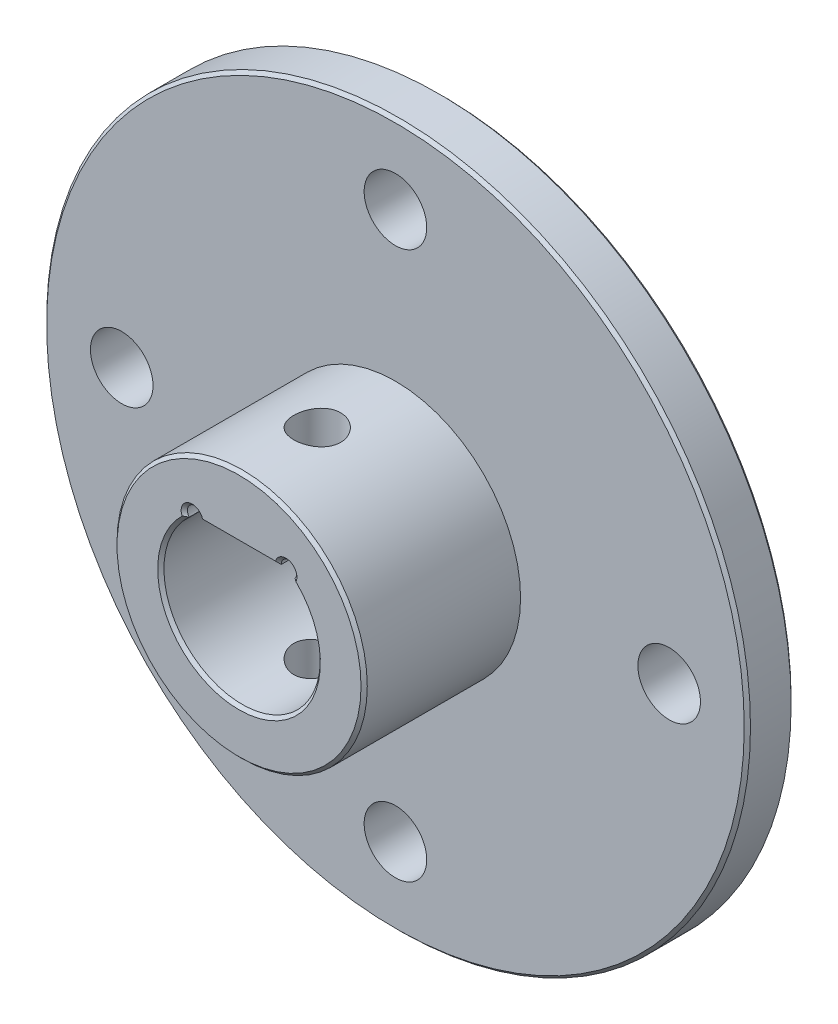
from build123d import *
from build123d.topology import SkipClean

# Parameters (mm, degrees)
SKETCH_1_R               = 22.5
SKETCH_1_R_2             = 2
EXTRUDE_1_DEPTH          = 3
SKETCH_2_R               = 8
EXTRUDE_2_DEPTH          = 10
CHAMFER_1_SIZE           = 0.2
CUT_EXTRUDE_1_DEPTH      = 35.372954485
CUT_EXTRUDE_1_DEPTH_BACK = 35.372954485
SKETCH_3_R               = 1.5


with BuildPart() as part:
    # 草图1 → 凸台-拉伸1 (new body)
    with BuildSketch(Plane.XY):
        Circle(SKETCH_1_R)
        with Locations((0, -17.5)):
            Circle(SKETCH_1_R_2, mode=Mode.SUBTRACT)
        with BuildLine():
            Line((-2.5, 4), (2.5, 4))
            ThreePointArc((2.5, 4), (3.169926685, 4.470239218), (3.384499687, 3.680375235))
            ThreePointArc((3.384499687, 3.680375235), (0, -5), (-3.384499687, 3.680375235))
            ThreePointArc((-3.384499687, 3.680375235), (-3.169926685, 4.470239218), (-2.5, 4))
        make_face(mode=Mode.SUBTRACT)
        with Locations((17.5, 0)):
            Circle(SKETCH_1_R_2, mode=Mode.SUBTRACT)
        with Locations((-17.5, 0)):
            Circle(SKETCH_1_R_2, mode=Mode.SUBTRACT)
        with Locations((0, 17.5)):
            Circle(SKETCH_1_R_2, mode=Mode.SUBTRACT)
    extrude(amount=EXTRUDE_1_DEPTH)

    # 草图2 → 凸台-拉伸2 (add)
    with SkipClean():  # the faces are left unmerged after this step: merging them gives an invalid solid
        with BuildSketch(Plane.XY.offset(3)):
            Circle(SKETCH_2_R)
            with BuildLine():
                Line((2.5, 4), (-2.5, 4))
                ThreePointArc((-2.5, 4), (-3.169926685, 4.470239218), (-3.384499687, 3.680375235))
                ThreePointArc((-3.384499687, 3.680375235), (0, -5), (3.384499687, 3.680375235))
                ThreePointArc((3.384499687, 3.680375235), (3.169926685, 4.470239218), (2.5, 4))
            make_face(mode=Mode.SUBTRACT)
        extrude(amount=EXTRUDE_2_DEPTH)

    # 倒角1
    chamfer_1_edges = [part.edges().sort_by_distance(p)[0] for p in [
        (0, -5, 13),
        (3.169926685, 4.470239218, 13),
        (-3.169926685, 4.470239218, 13),
        (0, 4, 13),
        (-8, 0, 13),
        (-22.5, 0, 0),
        (-22.5, 0, 3),
    ]]
    chamfer(chamfer_1_edges, length=CHAMFER_1_SIZE)

    # 草图3 → 切除-拉伸1 (cut, two sides: drawn at the far end of the back side and taken through both)
    with SkipClean():  # the faces are left unmerged after this step: merging them gives an invalid solid
        with BuildSketch(Plane(origin=(0, 0, 0), x_dir=(1, 0, 0), z_dir=(0, 1, 0)).offset(-CUT_EXTRUDE_1_DEPTH_BACK)):
            with Locations((0, -8)):
                Circle(SKETCH_3_R)
        extrude(amount=CUT_EXTRUDE_1_DEPTH + CUT_EXTRUDE_1_DEPTH_BACK, mode=Mode.SUBTRACT)


solid = part.part
